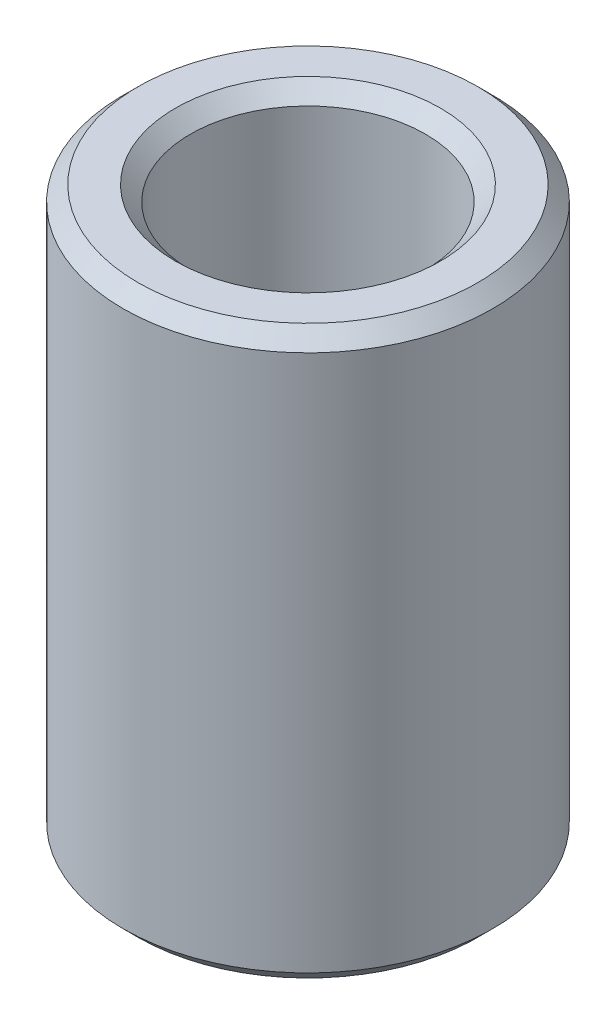
from build123d import *

# Parameters (mm, degrees)
SKETCH1_R           = 42.5
BOSS_EXTRUDE1_DEPTH = 130.366750899
SKETCH2_R           = 27.029192846
CUT_EXTRUDE1_DEPTH  = 144.554831824
CHAMFER1_SIZE       = 3.449989192


with BuildPart() as part:
    # Sketch1 → Boss-Extrude1 (new body)
    with BuildSketch(Plane(origin=(0, 0, 0), x_dir=(1, 0, 0), z_dir=(0, 1, 0))):
        Circle(SKETCH1_R)
    extrude(amount=BOSS_EXTRUDE1_DEPTH)

    # Sketch2 → Cut-Extrude1 (cut, through all)
    with BuildSketch(Plane(origin=(0, 0, 0), x_dir=(1, 0, 0), z_dir=(0, 1, 0))):
        Circle(SKETCH2_R)
    extrude(amount=CUT_EXTRUDE1_DEPTH, mode=Mode.SUBTRACT)

    # Chamfer1
    chamfer1_edges = [part.edges().sort_by_distance(p)[0] for p in [
        (-27.029192846, 130.366750899, 0),
        (-27.029192846, 0, 0),
        (-42.5, 0, 0),
        (-42.5, 130.366750899, 0),
    ]]
    chamfer(chamfer1_edges, length=CHAMFER1_SIZE)


solid = part.part
